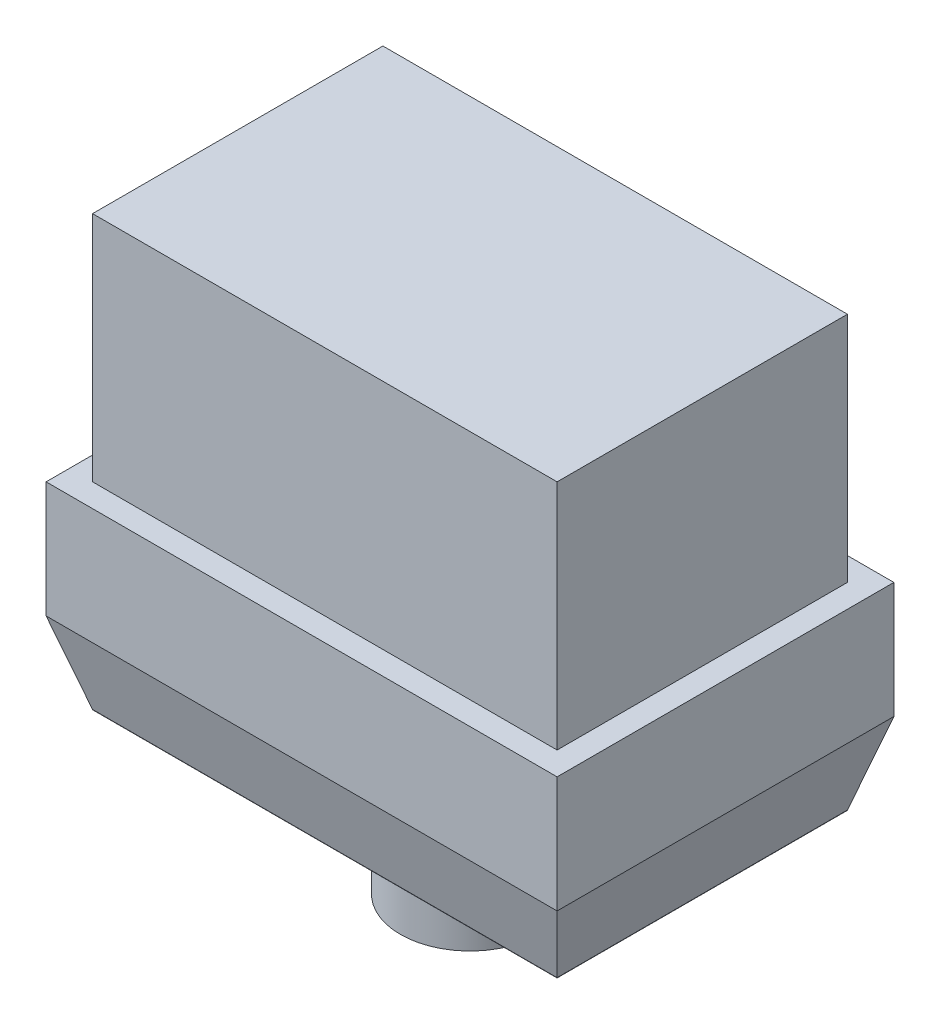
from build123d import *
from OCP.BRepFilletAPI import BRepFilletAPI_MakeChamfer

# Parameters (mm, degrees)
SKETCH1_W           = 40
SKETCH1_H           = 25
BOSS_EXTRUDE1_DEPTH = 30
SKETCH2_W           = 44
SKETCH2_H           = 29
BOSS_EXTRUDE2_DEPTH = 10
SKETCH3_W           = 40
SKETCH3_H           = 25
BOSS_EXTRUDE3_DEPTH = 14
SKETCH4_W           = 40
SKETCH4_H           = 25
CUT_EXTRUDE1_DEPTH  = 7
SKETCH5_R           = 4
SKETCH5_R_2         = 2.65
CUT_EXTRUDE2_DEPTH  = 3
SKETCH6_R           = 6
BOSS_EXTRUDE4_DEPTH = 10
CHAMFER1_SIZE       = 2
CHAMFER1_SIZE_2     = 6.974828888


with BuildPart() as part:
    # Sketch1 → Boss-Extrude1 (new body)
    with BuildSketch(Plane(origin=(0, 0, 0), x_dir=(1, 0, 0), z_dir=(0, 1, 0))):
        with Locations((20, 12.5)):
            Rectangle(SKETCH1_W, SKETCH1_H)
    extrude(amount=BOSS_EXTRUDE1_DEPTH)

    # Sketch2 → Boss-Extrude2 (add)
    with BuildSketch(Plane(origin=(0, 0, 0), x_dir=(1, 0, 0), z_dir=(0, 1, 0))):
        with Locations((20, 12.5)):
            Rectangle(SKETCH2_W, SKETCH2_H)
    extrude(amount=BOSS_EXTRUDE2_DEPTH)

    # Sketch3 → Boss-Extrude3 (add)
    with BuildSketch(Plane.XZ):
        with Locations((20, -12.5)):
            Rectangle(SKETCH3_W, SKETCH3_H)
    extrude(amount=BOSS_EXTRUDE3_DEPTH)

    # Sketch4 → Cut-Extrude1 (cut)
    with BuildSketch(Plane.XZ.offset(14)):
        with Locations((20, -12.5)):
            Rectangle(SKETCH4_W, SKETCH4_H)
    extrude(amount=-CUT_EXTRUDE1_DEPTH, mode=Mode.SUBTRACT)

    # Sketch5 → Cut-Extrude2 (cut)
    # profile 1 of 2: a face of its own
    with BuildSketch(Plane.XZ.offset(7)):
        with Locations(Location((6.5, -12.5, 0), (0, 0, 270))):
            Circle(SKETCH5_R)
        with Locations(Location((6.5, -12.5, 0), (0, 0, 270))):
            Circle(SKETCH5_R_2, mode=Mode.SUBTRACT)
    # profile 2 of 2: a face of its own
    with BuildSketch(Plane.XZ.offset(7)):
        with Locations(Location((33.5, -12.5, 0), (0, 0, 90))):
            Circle(SKETCH5_R)
        with Locations(Location((33.5, -12.5, 0), (0, 0, 90))):
            Circle(SKETCH5_R_2, mode=Mode.SUBTRACT)
    extrude(amount=-CUT_EXTRUDE2_DEPTH, mode=Mode.SUBTRACT)

    # Sketch6 → Boss-Extrude4 (add)
    with BuildSketch(Plane.XZ.offset(7)):
        with Locations(Location((20, -12.5, 0), (0, 0, 90))):
            Circle(SKETCH6_R)
    extrude(amount=BOSS_EXTRUDE4_DEPTH)

    # Chamfer1
    chamfer1_edges_1 = [part.edges().sort_by_distance(p)[0] for p in [
        (0, 0, -12.5),
    ]]
    chamfer1_side_1 = [part.faces().sort_by_distance(p)[0] for p in [
        (-0.04, 0, -12.5),
    ]]
    chamfer1_edges_2 = [part.edges().sort_by_distance(p)[0] for p in [
        (20, 0, -25),
    ]]
    chamfer1_side_2 = [part.faces().sort_by_distance(p)[0] for p in [
        (20, 0, -25.04),
    ]]
    chamfer1_edges_3 = [part.edges().sort_by_distance(p)[0] for p in [
        (40, 0, -12.5),
    ]]
    chamfer1_side_3 = [part.faces().sort_by_distance(p)[0] for p in [
        (40.04, 0, -12.5),
    ]]
    chamfer1_edges_4 = [part.edges().sort_by_distance(p)[0] for p in [
        (20, 0, 0),
    ]]
    chamfer1_side_4 = [part.faces().sort_by_distance(p)[0] for p in [
        (20, 0, 0.04),
    ]]
    chamfer1 = BRepFilletAPI_MakeChamfer(part.part.solid().wrapped)
    for e in chamfer1_edges_1:
        chamfer1.Add(CHAMFER1_SIZE - 0.0001, CHAMFER1_SIZE_2 - 0.0001, e.wrapped, chamfer1_side_1[0].wrapped)
    for e in chamfer1_edges_2:
        chamfer1.Add(CHAMFER1_SIZE - 0.0001, CHAMFER1_SIZE_2 - 0.0001, e.wrapped, chamfer1_side_2[0].wrapped)
    for e in chamfer1_edges_3:
        chamfer1.Add(CHAMFER1_SIZE - 0.0001, CHAMFER1_SIZE_2 - 0.0001, e.wrapped, chamfer1_side_3[0].wrapped)
    for e in chamfer1_edges_4:
        chamfer1.Add(CHAMFER1_SIZE - 0.0001, CHAMFER1_SIZE_2 - 0.0001, e.wrapped, chamfer1_side_4[0].wrapped)
    add(Compound.cast(chamfer1.Shape()), mode=Mode.REPLACE)  # a hair under: the kernel refuses the full size


solid = part.part
